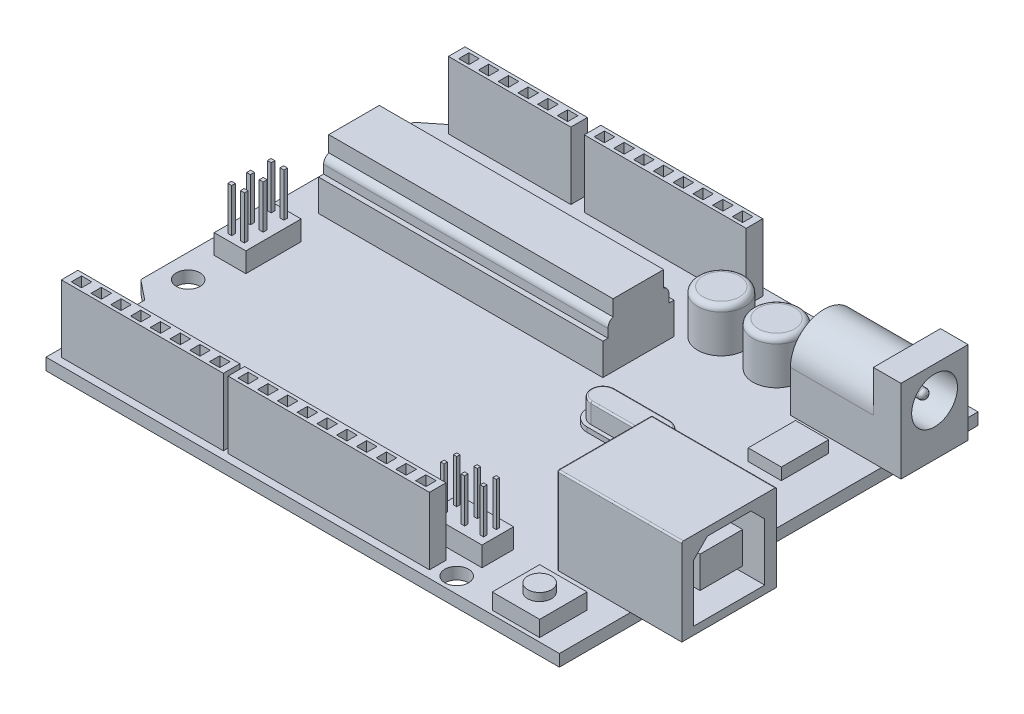
from build123d import *

# Parameters (mm, degrees)
BOSS_EXTRUDE1_DEPTH  = 1.5
SKETCH2_R            = 1.5
CUT_EXTRUDE1_DEPTH   = 44.926074261
SKETCH4_W            = 6
SKETCH4_H            = 6
BOSS_EXTRUDE3_DEPTH  = 2
SKETCH5_R            = 1.5
BOSS_EXTRUDE4_DEPTH  = 1
BOSS_EXTRUDE5_DEPTH  = 0.6
BOSS_EXTRUDE6_DEPTH  = 2.5
FILLET4_R            = 0.2
SKETCH8_W            = 15.8
SKETCH8_H            = 12
BOSS_EXTRUDE7_DEPTH  = 11
FILLET5_R            = 0.2
SKETCH9_W            = 14
SKETCH9_H            = 8.5
BOSS_EXTRUDE8_DEPTH  = 10.5
CUT_EXTRUDE2_DEPTH   = 10.5
SKETCH11_W           = 36
SKETCH11_H           = 9
BOSS_EXTRUDE9_DEPTH  = 4
SKETCH12_W           = 36
SKETCH12_H           = 7.708904374
BOSS_EXTRUDE10_DEPTH = 2
SKETCH13_W           = 36
SKETCH13_H           = 6.404220944
BOSS_EXTRUDE11_DEPTH = 2
FILLET6_R            = 1
SKETCH15_R           = 3
BOSS_EXTRUDE12_DEPTH = 5.5
FILLET7_R            = 0.7
SKETCH16_W           = 7
SKETCH16_H           = 4
SKETCH16_W_2         = 4
SKETCH16_H_2         = 7
BOSS_EXTRUDE13_DEPTH = 2.5
SKETCH17_W           = 0.484213036
SKETCH17_H           = 0.460805484
SKETCH17_W_2         = 0.496239012
SKETCH17_H_2         = 0.505759294
SKETCH17_H_3         = 0.462810424
SKETCH17_W_3         = 0.420132388
SKETCH17_H_4         = 0.410862884
SKETCH17_W_4         = 0.447771344
SKETCH17_W_5         = 0.43977372
SKETCH17_H_5         = 0.434573574
BOSS_EXTRUDE14_DEPTH = 5.5
SKETCH18_W           = 20.5
SKETCH18_H           = 2.1
SKETCH18_W_2         = 25.5
SKETCH18_W_3         = 15.5
BOSS_EXTRUDE15_DEPTH = 8.5
SKETCH19_W           = 1.3
SKETCH19_H           = 1.3
CUT_EXTRUDE4_DEPTH   = 6
SKETCH20_R           = 2.9
CUT_EXTRUDE5_DEPTH   = 12
SKETCH21_R           = 0.6
BOSS_EXTRUDE16_DEPTH = 11
FILLET8_R            = 0.5
CUT_EXTRUDE6_DEPTH   = 12
SKETCH23_W           = 5.4
SKETCH23_H           = 4
BOSS_EXTRUDE17_DEPTH = 11
SKETCH24_W           = 4.2
SKETCH24_H           = 6
BOSS_EXTRUDE18_DEPTH = 1.5


with BuildPart() as part:
    # Sketch1 → Boss-Extrude1 (new body)
    with BuildSketch(Plane(origin=(0, 0, 0), x_dir=(1, 0, 0), z_dir=(0, 1, 0))):
        Polygon((-32.5, -26.5), (-32.5, -14), (-35, -12), (-35, 22.5), (-32.5, 24.5), (-32.5, 26.5), (32.5, 26.5), (32.5, -26.5), align=None)
    extrude(amount=BOSS_EXTRUDE1_DEPTH)

    # Sketch2 → Cut-Extrude1 (cut, through all)
    with BuildSketch(Plane(origin=(0, 1.5, 0), x_dir=(1, 0, 0), z_dir=(0, 1, 0))):
        with Locations(Location((-32, 19, 0), (0, 0, 270))):
            Circle(SKETCH2_R)
        with Locations(Location((-32, -9, 0), (0, 0, 270))):
            Circle(SKETCH2_R)
        with Locations(Location((18.5, 24.5, 0), (0, 0, 270))):
            Circle(SKETCH2_R)
        with Locations(Location((17.5, -24.5, 0), (0, 0, 270))):
            Circle(SKETCH2_R)
    extrude(amount=-CUT_EXTRUDE1_DEPTH, mode=Mode.SUBTRACT)

    # Sketch4 → Boss-Extrude3 (add)
    with BuildSketch(Plane(origin=(0, 1.5, 0), x_dir=(1, 0, 0), z_dir=(0, 1, 0))):
        with Locations((26.5, -23)):
            Rectangle(SKETCH4_W, SKETCH4_H)
    extrude(amount=BOSS_EXTRUDE3_DEPTH)

    # Sketch5 → Boss-Extrude4 (add)
    with BuildSketch(Plane(origin=(0, 3.5, 0), x_dir=(1, 0, 0), z_dir=(0, 1, 0))):
        with Locations(Location((26.5, -23, 0), (0, 0, 270))):
            Circle(SKETCH5_R)
    extrude(amount=BOSS_EXTRUDE4_DEPTH)

    # Sketch6 → Boss-Extrude5 (add)
    with BuildSketch(Plane(origin=(0, 1.5, 0), x_dir=(1, 0, 0), z_dir=(0, 1, 0))):
        with BuildLine():
            Line((10, 3.5), (17, 3.5))
            ThreePointArc((17, 3.5), (19, 1.5), (17, -0.5))
            Line((17, -0.5), (10, -0.5))
            ThreePointArc((10, -0.5), (8, 1.5), (10, 3.5))
        make_face()
    extrude(amount=BOSS_EXTRUDE5_DEPTH)

    # Sketch7 → Boss-Extrude6 (add)
    with BuildSketch(Plane(origin=(0, 2.1, 0), x_dir=(1, 0, 0), z_dir=(0, 1, 0))):
        with BuildLine():
            Line((10, 3), (17, 3))
            ThreePointArc((17, 3), (18.5, 1.5), (17, 0))
            Line((17, 0), (10, 0))
            ThreePointArc((10, 0), (8.5, 1.5), (10, 3))
        make_face()
    extrude(amount=BOSS_EXTRUDE6_DEPTH)

    # Fillet4
    fillet4_edges = [part.edges().sort_by_distance(p)[0] for p in [
        (8.5, 4.6, -1.5),
        (13.5, 4.6, 0),
        (18.5, 4.6, -1.5),
        (13.5, 4.6, -3),
    ]]
    fillet(fillet4_edges, radius=FILLET4_R)

    # Sketch8 → Boss-Extrude7 (add)
    with BuildSketch(Plane(origin=(0, 1.5, 0), x_dir=(1, 0, 0), z_dir=(0, 1, 0))):
        with Locations((31.1, -11.5)):
            Rectangle(SKETCH8_W, SKETCH8_H)
    extrude(amount=BOSS_EXTRUDE7_DEPTH)

    # Fillet5
    fillet5_edges = [part.edges().sort_by_distance(p)[0] for p in [
        (23.2, 7, 5.5),
        (23.2, 7, 17.5),
        (31.1, 12.5, 5.5),
        (23.2, 12.5, 11.5),
        (31.1, 12.5, 17.5),
    ]]
    fillet(fillet5_edges, radius=FILLET5_R)

    # Sketch9 → Boss-Extrude8 (add)
    with BuildSketch(Plane(origin=(0, 1.5, 0), x_dir=(1, 0, 0), z_dir=(0, 1, 0))):
        with Locations((28, 18.5)):
            Rectangle(SKETCH9_W, SKETCH9_H)
    extrude(amount=BOSS_EXTRUDE8_DEPTH)

    # Sketch10 → Cut-Extrude2 (cut)
    with BuildSketch(Plane.ZY.offset(-21)):
        with BuildLine():
            Line((-22.75, 6.75), (-24.834108127, 6.75))
            Line((-24.834108127, 6.75), (-24.834108127, 13.708496327))
            Line((-24.834108127, 13.708496327), (-12.94171832, 13.708496327))
            Line((-12.94171832, 13.708496327), (-12.94171832, 6.75))
            Line((-12.94171832, 6.75), (-14.25, 6.75))
            ThreePointArc((-14.25, 6.75), (-18.5, 11), (-22.75, 6.75))
        make_face()
    extrude(amount=-CUT_EXTRUDE2_DEPTH, mode=Mode.SUBTRACT)

    # Sketch11 → Boss-Extrude9 (add)
    with BuildSketch(Plane(origin=(0, 1.5, 0), x_dir=(1, 0, 0), z_dir=(0, 1, 0))):
        with Locations((-13, 11)):
            Rectangle(SKETCH11_W, SKETCH11_H)
    extrude(amount=BOSS_EXTRUDE9_DEPTH)

    # Sketch12 → Boss-Extrude10 (add)
    with BuildSketch(Plane(origin=(0, 5.5, 0), x_dir=(1, 0, 0), z_dir=(0, 1, 0))):
        with Locations((-13, 11)):
            Rectangle(SKETCH12_W, SKETCH12_H)
    extrude(amount=BOSS_EXTRUDE10_DEPTH)

    # Sketch13 → Boss-Extrude11 (add)
    with BuildSketch(Plane(origin=(0, 7.5, 0), x_dir=(1, 0, 0), z_dir=(0, 1, 0))):
        with Locations((-13, 11)):
            Rectangle(SKETCH13_W, SKETCH13_H)
    extrude(amount=BOSS_EXTRUDE11_DEPTH)

    # Fillet6
    # the kernel refuses this fillet: 1 mm, written as the material it takes off along each edge
    with BuildSketch(Plane(origin=(-33.344053269, 7.5, -14.854452187), x_dir=(0, -1, 0), z_dir=(1, 0, 0))) as fillet6_piece_1:
        with BuildLine():
            CenterArc((0.937621308, -1), FILLET6_R, 90, 69.655847889)
            Line((0, -0.652341715), (-0.018752426, -0.645388549))
            ThreePointArc((-0.018752426, -0.645388549), (-0.02, -0.326170857), (-0.02, 0))
            Line((-0.02, 0), (0, 0.02))
            Line((0, 0.02), (0.937621308, 0.02))
            Line((0.937621308, 0.02), (0.937621308, 0))
        make_face()
    extrude(amount=40.688106538, mode=Mode.SUBTRACT)
    with BuildSketch(Plane(origin=(7.344053269, 7.5, -7.145547813), x_dir=(0, 0, -1), z_dir=(-1, 0, 0))) as fillet6_piece_2:
        with BuildLine():
            CenterArc((1, 0.937621308), FILLET6_R, 180, 69.655847889)
            Line((0, 0.937621308), (-0.02, 0.937621308))
            Line((-0.02, 0.937621308), (-0.02, 0))
            Line((-0.02, 0), (0, -0.02))
            ThreePointArc((0, -0.02), (0.326170857, -0.02), (0.645388549, -0.018752426))
            Line((0.645388549, -0.018752426), (0.652341715, 0))
        make_face()
    extrude(amount=40.688106538, mode=Mode.SUBTRACT)

    # Sketch15 → Boss-Extrude12 (add)
    with BuildSketch(Plane(origin=(0, 1.5, 0), x_dir=(1, 0, 0), z_dir=(0, 1, 0))):
        with Locations(Location((15, 18.5, 0), (0, 0, 270))):
            Circle(SKETCH15_R)
        with Locations(Location((8, 18.5, 0), (0, 0, 270))):
            Circle(SKETCH15_R)
    extrude(amount=BOSS_EXTRUDE12_DEPTH)

    # Fillet7
    fillet7_edges = [part.edges().sort_by_distance(p)[0] for p in [
        (15, 7, -21.5),
        (8, 7, -21.5),
    ]]
    fillet(fillet7_edges, radius=FILLET7_R)

    # Sketch16 → Boss-Extrude13 (add)
    with BuildSketch(Plane(origin=(0, 1.5, 0), x_dir=(1, 0, 0), z_dir=(0, 1, 0))):
        with Locations((14.7, -20)):
            Rectangle(SKETCH16_W, SKETCH16_H)
        with Locations((-31, -1.2)):
            Rectangle(SKETCH16_W_2, SKETCH16_H_2)
    extrude(amount=BOSS_EXTRUDE13_DEPTH)

    # Sketch17 → Boss-Extrude14 (add)
    with BuildSketch(Plane(origin=(0, 4, 0), x_dir=(1, 0, 0), z_dir=(0, 1, 0))):
        with Locations((-31.8, 1.3)):
            Rectangle(SKETCH17_W, SKETCH17_H)
        with Locations((-30.2, 1.3)):
            Rectangle(SKETCH17_W_2, SKETCH17_H)
        with Locations((-31.8, -1.3)):
            Rectangle(SKETCH17_W, SKETCH17_H_2)
        with Locations((-30.2, -1.3)):
            Rectangle(SKETCH17_W_2, SKETCH17_H_2)
        with Locations((-31.8, -3.7)):
            Rectangle(SKETCH17_W, SKETCH17_H_3)
        with Locations((-30.2, -3.7)):
            Rectangle(SKETCH17_W_2, SKETCH17_H_3)
        with Locations((12.2, -19.2)):
            Rectangle(SKETCH17_W_3, SKETCH17_H_4)
        with Locations((14.8, -19.2)):
            Rectangle(SKETCH17_W_4, SKETCH17_H_4)
        with Locations((17.2, -19.2)):
            Rectangle(SKETCH17_W_5, SKETCH17_H_4)
        with Locations((12.2, -20.8)):
            Rectangle(SKETCH17_W_3, SKETCH17_H_5)
        with Locations((14.8, -20.8)):
            Rectangle(SKETCH17_W_4, SKETCH17_H_5)
        with Locations((17.2, -20.8)):
            Rectangle(SKETCH17_W_5, SKETCH17_H_5)
    extrude(amount=BOSS_EXTRUDE14_DEPTH)

    # Sketch18 → Boss-Extrude15 (add)
    with BuildSketch(Plane(origin=(0, 1.5, 0), x_dir=(1, 0, 0), z_dir=(0, 1, 0))):
        with Locations((-21.25, -24.5)):
            Rectangle(SKETCH18_W, SKETCH18_H)
        with Locations((2.35, -24.5)):
            Rectangle(SKETCH18_W_2, SKETCH18_H)
        with Locations((-23.75, 24.5)):
            Rectangle(SKETCH18_W_3, SKETCH18_H)
        with Locations((-4.05, 24.5)):
            Rectangle(SKETCH18_W, SKETCH18_H)
    extrude(amount=BOSS_EXTRUDE15_DEPTH)

    # Sketch19 → Cut-Extrude4 (cut)
    with BuildSketch(Plane(origin=(0, 10, 0), x_dir=(1, 0, 0), z_dir=(0, 1, 0))):
        with Locations((-6.4, -24.5)):
            Rectangle(SKETCH19_W, SKETCH19_H)
        with Locations((-8.9, -24.5)):
            Rectangle(SKETCH19_W, SKETCH19_H)
        with Locations((-3.9, -24.5)):
            Rectangle(SKETCH19_W, SKETCH19_H)
        with Locations((-1.4, -24.5)):
            Rectangle(SKETCH19_W, SKETCH19_H)
        with Locations((1.1, -24.5)):
            Rectangle(SKETCH19_W, SKETCH19_H)
        with Locations((3.6, -24.5)):
            Rectangle(SKETCH19_W, SKETCH19_H)
        with Locations((6.1, -24.5)):
            Rectangle(SKETCH19_W, SKETCH19_H)
        with Locations((8.6, -24.5)):
            Rectangle(SKETCH19_W, SKETCH19_H)
        with Locations((11.1, -24.5)):
            Rectangle(SKETCH19_W, SKETCH19_H)
        with Locations((13.6, -24.5)):
            Rectangle(SKETCH19_W, SKETCH19_H)
        with Locations((-27.5, -24.5)):
            Rectangle(SKETCH19_W, SKETCH19_H)
        with Locations((-30, -24.5)):
            Rectangle(SKETCH19_W, SKETCH19_H)
        with Locations((-25, -24.5)):
            Rectangle(SKETCH19_W, SKETCH19_H)
        with Locations((-22.5, -24.5)):
            Rectangle(SKETCH19_W, SKETCH19_H)
        with Locations((-20, -24.5)):
            Rectangle(SKETCH19_W, SKETCH19_H)
        with Locations((-17.5, -24.5)):
            Rectangle(SKETCH19_W, SKETCH19_H)
        with Locations((-15, -24.5)):
            Rectangle(SKETCH19_W, SKETCH19_H)
        with Locations((-12.5, -24.5)):
            Rectangle(SKETCH19_W, SKETCH19_H)
        with Locations((-27.45, 24.5)):
            Rectangle(SKETCH19_W, SKETCH19_H)
        with Locations((-29.95, 24.5)):
            Rectangle(SKETCH19_W, SKETCH19_H)
        with Locations((-24.95, 24.5)):
            Rectangle(SKETCH19_W, SKETCH19_H)
        with Locations((-22.45, 24.5)):
            Rectangle(SKETCH19_W, SKETCH19_H)
        with Locations((-19.95, 24.5)):
            Rectangle(SKETCH19_W, SKETCH19_H)
        with Locations((-17.45, 24.5)):
            Rectangle(SKETCH19_W, SKETCH19_H)
        with Locations((-10.3, 24.5)):
            Rectangle(SKETCH19_W, SKETCH19_H)
        with Locations((-12.8, 24.5)):
            Rectangle(SKETCH19_W, SKETCH19_H)
        with Locations((-7.8, 24.5)):
            Rectangle(SKETCH19_W, SKETCH19_H)
        with Locations((-5.3, 24.5)):
            Rectangle(SKETCH19_W, SKETCH19_H)
        with Locations((-2.8, 24.5)):
            Rectangle(SKETCH19_W, SKETCH19_H)
        with Locations((-0.3, 24.5)):
            Rectangle(SKETCH19_W, SKETCH19_H)
        with Locations((2.2, 24.5)):
            Rectangle(SKETCH19_W, SKETCH19_H)
        with Locations((4.7, 24.5)):
            Rectangle(SKETCH19_W, SKETCH19_H)
    extrude(amount=-CUT_EXTRUDE4_DEPTH, mode=Mode.SUBTRACT)

    # Sketch20 → Cut-Extrude5 (cut)
    with BuildSketch(Plane(origin=(35, 0, 0), x_dir=(0, 0, -1), z_dir=(1, 0, 0))):
        with Locations((18.5, 8)):
            Circle(SKETCH20_R)
    extrude(amount=-CUT_EXTRUDE5_DEPTH, mode=Mode.SUBTRACT)

    # Sketch21 → Boss-Extrude16 (add)
    with BuildSketch(Plane(origin=(23, 0, 0), x_dir=(0, 0, -1), z_dir=(1, 0, 0))):
        with Locations((18.5, 8)):
            Circle(SKETCH21_R)
    extrude(amount=BOSS_EXTRUDE16_DEPTH)

    # Fillet8
    fillet8_edges = [part.edges().sort_by_distance(p)[0] for p in [
        (34, 8, -17.9),
    ]]
    fillet(fillet8_edges, radius=FILLET8_R)

    # Sketch22 → Cut-Extrude6 (cut)
    with BuildSketch(Plane(origin=(39, 0, 0), x_dir=(0, 0, -1), z_dir=(1, 0, 0))):
        Polygon((-16, 2.5), (-7, 2.5), (-7, 9.75), (-8.75, 11.5), (-14.25, 11.5), (-16, 9.75), align=None)
    extrude(amount=-CUT_EXTRUDE6_DEPTH, mode=Mode.SUBTRACT)

    # Sketch23 → Boss-Extrude17 (add)
    with BuildSketch(Plane(origin=(27, 0, 0), x_dir=(0, 0, -1), z_dir=(1, 0, 0))):
        with Locations((-11.5, 7)):
            Rectangle(SKETCH23_W, SKETCH23_H)
    extrude(amount=BOSS_EXTRUDE17_DEPTH)

    # Sketch24 → Boss-Extrude18 (add)
    with BuildSketch(Plane(origin=(0, 1.5, 0), x_dir=(1, 0, 0), z_dir=(0, 1, 0))):
        with Locations((25.5, 9.5)):
            Rectangle(SKETCH24_W, SKETCH24_H)
    extrude(amount=BOSS_EXTRUDE18_DEPTH)


solid = part.part
